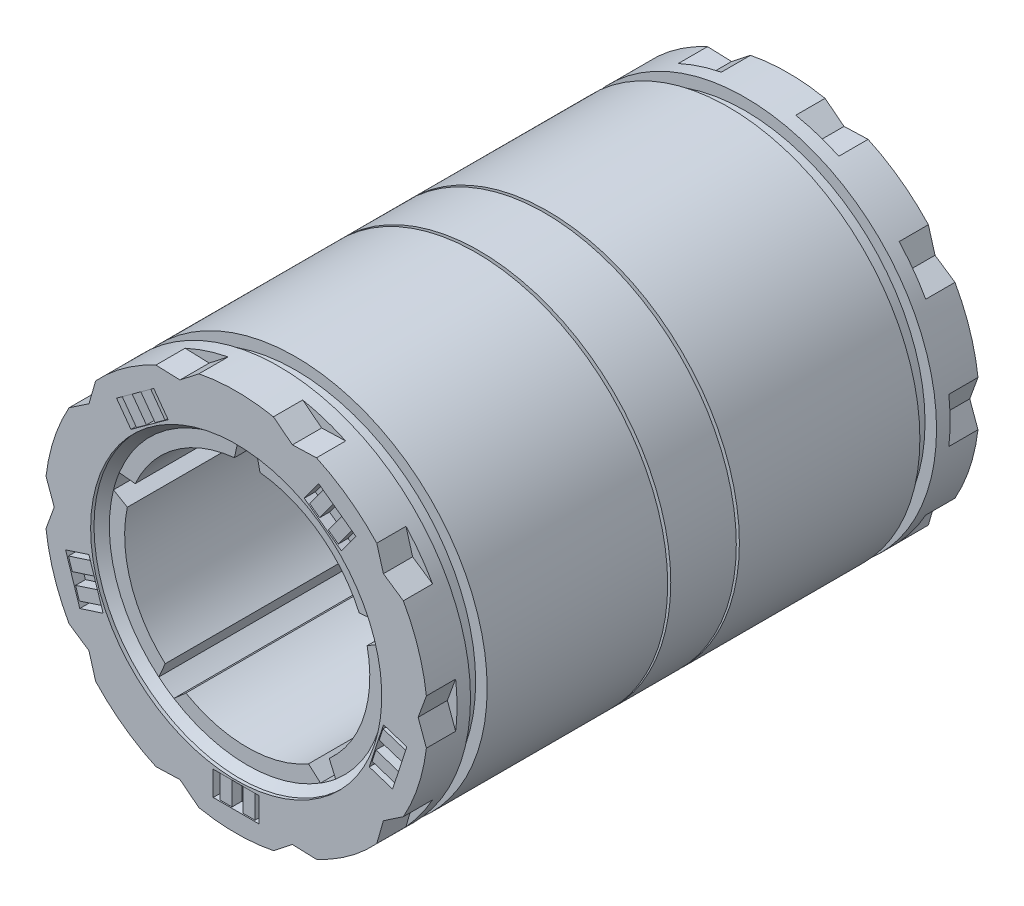
from build123d import *

# Parameters (mm, degrees)
CUT_EXTRUDE1_DEPTH      = 41.050960702
CUT_EXTRUDE1_DEPTH_BACK = 41.050960702
CUT_EXTRUDE2_START      = 28.575
SKETCH5_R               = 15.08125
CUT_EXTRUDE2_DEPTH      = 1.143
CUT_EXTRUDE3_START      = -27.432
SKETCH5_2_R             = 15.08125
CUT_EXTRUDE3_DEPTH      = 1.143
CHAMFER1_SIZE           = 0.79375
CUT_EXTRUDE5_START      = 25.54605
CUT_EXTRUDE5_DEPTH      = 3.02895
CUT_EXTRUDE6_START      = -28.575
CUT_EXTRUDE6_DEPTH      = 3.02895
CUT_EXTRUDE7_START      = 28.575
SKETCH9_W               = 0.555625
SKETCH9_H               = 2.54
SKETCH9_W_2             = 1.11125
CUT_EXTRUDE7_DEPTH      = 1.143
CUT_EXTRUDE8_START      = 28.575
SKETCH10_W              = 4.7625
SKETCH10_H              = 2.54
CUT_EXTRUDE8_DEPTH      = 0.127
CUT_EXTRUDE9_START      = -28.575
SKETCH9_2_W             = 0.555625
SKETCH9_2_H             = 2.54
SKETCH9_2_W_2           = 1.11125
CUT_EXTRUDE9_DEPTH      = 1.143
CUT_EXTRUDE11_START     = -28.575
SKETCH10_2_W            = 4.7625
SKETCH10_2_H            = 2.54
CUT_EXTRUDE11_DEPTH     = 0.127
CIRPATTERN2_COUNT       = 5


with BuildPart() as part:
    # Sketch3 → Revolve1 (revolve)
    with BuildSketch(Plane(origin=(0, 0, 0), x_dir=(0, 0, -1), z_dir=(1, 0, 0)), mode=Mode.PRIVATE) as revolve1_sk:
        Polygon((-28.575, 12.7), (-28.575, 19.84375), (-24.1427, 19.84375), (-24.1427, 18.64995), (-22.4155, 18.64995), (-22.4155, 19.84375), (-3.71475, 19.84375), (-3.71475, 19.05), (-3.39471, 19.05), (-3.39471, 19.84375), (3.39471, 19.84375), (3.39471, 19.05), (3.71475, 19.05), (3.71475, 19.84375), (22.4155, 19.84375), (22.4155, 18.64995), (24.1427, 18.64995), (24.1427, 19.84375), (28.575, 19.84375), (28.575, 12.7), align=None)
    revolve(revolve1_sk.sketch.rotate(Axis((0, 0, 28.575), (0, 0, -1)), 90), axis=Axis((0, 0, 28.575), (0, 0, -1)))

    # Sketch4 → Cut-Extrude1 (cut, two sides: drawn at the far end of the back side and taken through both)
    with BuildSketch(Plane.XY.offset(-CUT_EXTRUDE1_DEPTH_BACK)):
        with BuildLine():
            Line((-6.35, -10.998522628), (-7.596051743, -12.100936086))
            ThreePointArc((-7.596051743, -12.100936086), (-8.397981792, -11.558830307), (-9.161365039, -10.963669407))
            Line((-9.161365039, -10.963669407), (-8.497958701, -9.437939284))
            ThreePointArc((-8.497958701, -9.437939284), (-7.464872704, -10.274515829), (-6.35, -10.998522628))
        make_face()
        with BuildLine():
            Line((-12.422474529, 2.640478473), (-13.855983197, 3.48487961))
            ThreePointArc((-13.855983197, 3.48487961), (-13.588219977, 4.415080307), (-13.258086721, 5.325015751))
            Line((-13.258086721, 5.325015751), (-11.602027312, 5.165555367))
            ThreePointArc((-11.602027312, 5.165555367), (-12.078417757, 3.924515829), (-12.422474529, 2.640478473))
        make_face()
        with BuildLine():
            Line((6.35, -10.998522628), (7.596051743, -12.100936086))
            ThreePointArc((7.596051743, -12.100936086), (8.397981792, -11.558830307), (9.161365039, -10.963669407))
            Line((9.161365039, -10.963669407), (8.497958701, -9.437939284))
            ThreePointArc((8.497958701, -9.437939284), (7.464872704, -10.274515829), (6.35, -10.998522628))
        make_face()
        with BuildLine():
            Line((-1.327511483, 12.630428071), (-0.96741682, 14.254710132))
            ThreePointArc((-0.96741682, 14.254710132), (0, 14.2875), (0.96741682, 14.254710132))
            Line((0.96741682, 14.254710132), (1.327511483, 12.630428071))
            ThreePointArc((1.327511483, 12.630428071), (0, 12.7), (-1.327511483, 12.630428071))
        make_face()
        with BuildLine():
            Line((11.602027312, 5.165555367), (13.258086721, 5.325015751))
            ThreePointArc((13.258086721, 5.325015751), (13.588219977, 4.415080307), (13.855983197, 3.48487961))
            Line((13.855983197, 3.48487961), (12.422474529, 2.640478473))
            ThreePointArc((12.422474529, 2.640478473), (12.078417757, 3.924515829), (11.602027312, 5.165555367))
        make_face()
    extrude(amount=CUT_EXTRUDE1_DEPTH + CUT_EXTRUDE1_DEPTH_BACK, mode=Mode.SUBTRACT)

    # Sketch5 → Cut-Extrude2 (cut)
    with BuildSketch(Plane.XY.offset(CUT_EXTRUDE2_START)):
        with Locations(Location((0, 0, 0), (0, 0, 180))):
            Circle(SKETCH5_R)
    extrude(amount=-CUT_EXTRUDE2_DEPTH, mode=Mode.SUBTRACT)

    # Sketch5<2> → Cut-Extrude3 (cut)
    with BuildSketch(Plane.XY.offset(CUT_EXTRUDE3_START)):
        with Locations(Location((0, 0, 0), (0, 0, 180))):
            Circle(SKETCH5_2_R)
    extrude(amount=-CUT_EXTRUDE3_DEPTH, mode=Mode.SUBTRACT)

    # Chamfer1
    chamfer1_edges = [part.edges().sort_by_distance(p)[0] for p in [
        (15.08125, 0, 27.432),
        (15.08125, 0, -27.432),
    ]]
    chamfer(chamfer1_edges, length=CHAMFER1_SIZE - 0.0001)  # a hair under: the kernel refuses the full size

    # Sketch8 → Cut-Extrude5 (cut)
    with BuildSketch(Plane.XY.offset(CUT_EXTRUDE5_START)):
        with BuildLine():
            Line((-8.31861959, 18.015964647), (-5.825453183, 17.928901358))
            Line((-5.825453183, 17.928901358), (-3.859613707, 19.464783484))
            ThreePointArc((-3.859613707, 19.464783484), (-6.132055982, 18.872527745), (-8.31861959, 18.015964647))
        make_face()
        with BuildLine():
            Line((3.859613707, 19.464783484), (5.825453183, 17.928901358))
            Line((5.825453183, 17.928901358), (8.31861959, 18.015964647))
            ThreePointArc((8.31861959, 18.015964647), (6.132055982, 18.872527745), (3.859613707, 19.464783484))
        make_face()
        with BuildLine():
            Line((14.563605752, 13.478716614), (15.251234433, 11.08067042))
            Line((15.251234433, 11.08067042), (17.319422944, 9.685659655))
            ThreePointArc((17.319422944, 9.685659655), (16.053930982, 11.6638636), (14.563605752, 13.478716614))
        make_face()
        with BuildLine():
            Line((19.704795398, 2.344238122), (18.8515625, 0))
            Line((18.8515625, 0), (19.704795398, -2.344238122))
            ThreePointArc((19.704795398, -2.344238122), (19.84375, 0), (19.704795398, 2.344238122))
        make_face()
        with BuildLine():
            Line((17.319422944, -9.685659655), (15.251234433, -11.08067042))
            Line((15.251234433, -11.08067042), (14.563605752, -13.478716614))
            ThreePointArc((14.563605752, -13.478716614), (16.053930982, -11.6638636), (17.319422944, -9.685659655))
        make_face()
        with BuildLine():
            Line((8.31861959, -18.015964647), (5.825453183, -17.928901358))
            Line((5.825453183, -17.928901358), (3.859613707, -19.464783484))
            ThreePointArc((3.859613707, -19.464783484), (6.132055982, -18.872527745), (8.31861959, -18.015964647))
        make_face()
        with BuildLine():
            Line((-3.859613707, -19.464783484), (-5.825453183, -17.928901358))
            Line((-5.825453183, -17.928901358), (-8.31861959, -18.015964647))
            ThreePointArc((-8.31861959, -18.015964647), (-6.132055982, -18.872527745), (-3.859613707, -19.464783484))
        make_face()
        with BuildLine():
            Line((-14.563605752, -13.478716614), (-15.251234433, -11.08067042))
            Line((-15.251234433, -11.08067042), (-17.319422944, -9.685659655))
            ThreePointArc((-17.319422944, -9.685659655), (-16.053930982, -11.6638636), (-14.563605752, -13.478716614))
        make_face()
        with BuildLine():
            Line((-19.704795398, -2.344238122), (-18.8515625, 0))
            Line((-18.8515625, 0), (-19.704795398, 2.344238122))
            ThreePointArc((-19.704795398, 2.344238122), (-19.84375, 0), (-19.704795398, -2.344238122))
        make_face()
        with BuildLine():
            Line((-17.319422944, 9.685659655), (-15.251234433, 11.08067042))
            Line((-15.251234433, 11.08067042), (-14.563605752, 13.478716614))
            ThreePointArc((-14.563605752, 13.478716614), (-16.053930982, 11.6638636), (-17.319422944, 9.685659655))
        make_face()
    extrude(amount=CUT_EXTRUDE5_DEPTH, mode=Mode.SUBTRACT)

    # Sketch8<2> → Cut-Extrude6 (cut)
    with BuildSketch(Plane.XY.offset(CUT_EXTRUDE6_START)):
        with BuildLine():
            Line((-8.31861959, 18.015964647), (-5.825453183, 17.928901358))
            Line((-5.825453183, 17.928901358), (-3.859613707, 19.464783484))
            ThreePointArc((-3.859613707, 19.464783484), (-6.132055982, 18.872527745), (-8.31861959, 18.015964647))
        make_face()
        with BuildLine():
            Line((3.859613707, 19.464783484), (5.825453183, 17.928901358))
            Line((5.825453183, 17.928901358), (8.31861959, 18.015964647))
            ThreePointArc((8.31861959, 18.015964647), (6.132055982, 18.872527745), (3.859613707, 19.464783484))
        make_face()
        with BuildLine():
            Line((14.563605752, 13.478716614), (15.251234433, 11.08067042))
            Line((15.251234433, 11.08067042), (17.319422944, 9.685659655))
            ThreePointArc((17.319422944, 9.685659655), (16.053930982, 11.6638636), (14.563605752, 13.478716614))
        make_face()
        with BuildLine():
            Line((19.704795398, 2.344238122), (18.8515625, 0))
            Line((18.8515625, 0), (19.704795398, -2.344238122))
            ThreePointArc((19.704795398, -2.344238122), (19.84375, 0), (19.704795398, 2.344238122))
        make_face()
        with BuildLine():
            Line((17.319422944, -9.685659655), (15.251234433, -11.08067042))
            Line((15.251234433, -11.08067042), (14.563605752, -13.478716614))
            ThreePointArc((14.563605752, -13.478716614), (16.053930982, -11.6638636), (17.319422944, -9.685659655))
        make_face()
        with BuildLine():
            Line((8.31861959, -18.015964647), (5.825453183, -17.928901358))
            Line((5.825453183, -17.928901358), (3.859613707, -19.464783484))
            ThreePointArc((3.859613707, -19.464783484), (6.132055982, -18.872527745), (8.31861959, -18.015964647))
        make_face()
        with BuildLine():
            Line((-3.859613707, -19.464783484), (-5.825453183, -17.928901358))
            Line((-5.825453183, -17.928901358), (-8.31861959, -18.015964647))
            ThreePointArc((-8.31861959, -18.015964647), (-6.132055982, -18.872527745), (-3.859613707, -19.464783484))
        make_face()
        with BuildLine():
            Line((-14.563605752, -13.478716614), (-15.251234433, -11.08067042))
            Line((-15.251234433, -11.08067042), (-17.319422944, -9.685659655))
            ThreePointArc((-17.319422944, -9.685659655), (-16.053930982, -11.6638636), (-14.563605752, -13.478716614))
        make_face()
        with BuildLine():
            Line((-19.704795398, -2.344238122), (-18.8515625, 0))
            Line((-18.8515625, 0), (-19.704795398, 2.344238122))
            ThreePointArc((-19.704795398, 2.344238122), (-19.84375, 0), (-19.704795398, -2.344238122))
        make_face()
        with BuildLine():
            Line((-17.319422944, 9.685659655), (-15.251234433, 11.08067042))
            Line((-15.251234433, 11.08067042), (-14.563605752, 13.478716614))
            ThreePointArc((-14.563605752, 13.478716614), (-16.053930982, 11.6638636), (-17.319422944, 9.685659655))
        make_face()
    extrude(amount=CUT_EXTRUDE6_DEPTH, mode=Mode.SUBTRACT)

    # Sketch9 → Cut-Extrude7 (cut)
    with BuildSketch(Plane.XY.offset(CUT_EXTRUDE7_START)):
        with Locations((-2.1034375, -16.54175)):
            Rectangle(SKETCH9_W, SKETCH9_H)
        with Locations((2.1034375, -16.54175)):
            Rectangle(SKETCH9_W, SKETCH9_H)
        with Locations((0, -16.54175)):
            Rectangle(SKETCH9_W_2, SKETCH9_H)
    cut_extrude7 = extrude(amount=-CUT_EXTRUDE7_DEPTH, mode=Mode.SUBTRACT)

    # Sketch10 → Cut-Extrude8 (cut)
    with BuildSketch(Plane.XY.offset(CUT_EXTRUDE8_START)):
        with Locations((0, -16.54175)):
            Rectangle(SKETCH10_W, SKETCH10_H)
    cut_extrude8 = extrude(amount=-CUT_EXTRUDE8_DEPTH, mode=Mode.SUBTRACT)

    # Sketch9<2> → Cut-Extrude9 (cut)
    with BuildSketch(Plane.XY.offset(CUT_EXTRUDE9_START)):
        with Locations((-2.1034375, -16.54175)):
            Rectangle(SKETCH9_2_W, SKETCH9_2_H)
        with Locations((2.1034375, -16.54175)):
            Rectangle(SKETCH9_2_W, SKETCH9_2_H)
        with Locations((0, -16.54175)):
            Rectangle(SKETCH9_2_W_2, SKETCH9_2_H)
    cut_extrude9 = extrude(amount=CUT_EXTRUDE9_DEPTH, mode=Mode.SUBTRACT)

    # Sketch10<2> → Cut-Extrude11 (cut)
    with BuildSketch(Plane.XY.offset(CUT_EXTRUDE11_START)):
        with Locations((0, -16.54175)):
            Rectangle(SKETCH10_2_W, SKETCH10_2_H)
    cut_extrude11 = extrude(amount=CUT_EXTRUDE11_DEPTH, mode=Mode.SUBTRACT)

    # CirPattern2: Cut-Extrude7, Cut-Extrude8, Cut-Extrude9, Cut-Extrude11 ×5 about axis
    cirpattern2_axis = Axis((0, 0, 0), (0, 0, 1))
    add([cut_extrude7.rotate(cirpattern2_axis, i * 360 / CIRPATTERN2_COUNT) for i in range(1, CIRPATTERN2_COUNT)], mode=Mode.SUBTRACT)
    add([cut_extrude8.rotate(cirpattern2_axis, i * 360 / CIRPATTERN2_COUNT) for i in range(1, CIRPATTERN2_COUNT)], mode=Mode.SUBTRACT)
    add([cut_extrude9.rotate(cirpattern2_axis, i * 360 / CIRPATTERN2_COUNT) for i in range(1, CIRPATTERN2_COUNT)], mode=Mode.SUBTRACT)
    add([cut_extrude11.rotate(cirpattern2_axis, i * 360 / CIRPATTERN2_COUNT) for i in range(1, CIRPATTERN2_COUNT)], mode=Mode.SUBTRACT)


solid = part.part
